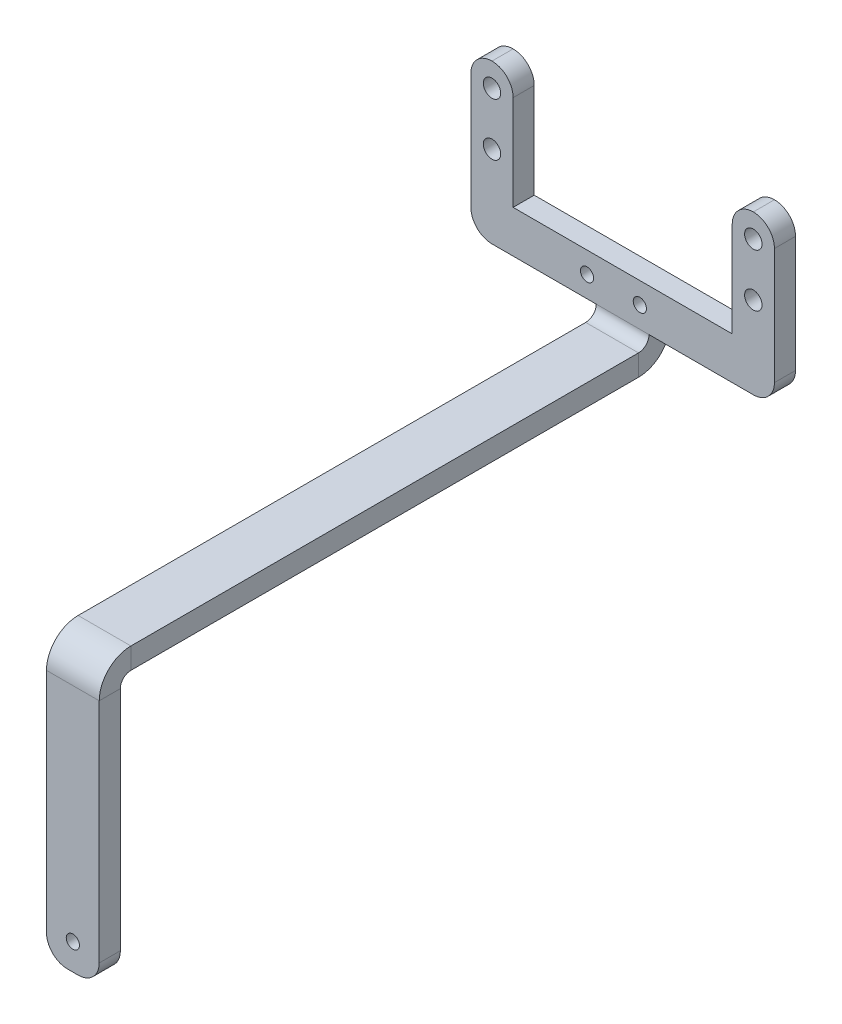
from build123d import *

# Parameters (mm, degrees)
EXTRUDE_1_DEPTH                  = 3
SHEET_METAL_1_OUTLINE_W          = 8
SHEET_METAL_1_OUTLINE_H          = 1
SHEET_METAL_1_DEPTH              = 57.5
SHEET_METAL_1_2_OUTLINE_W        = 22
SHEET_METAL_1_2_OUTLINE_H        = 1
SHEET_METAL_1_2_DEPTH            = 8
SHEET_START                      = 49.5
SHEET_METAL_1_3_OUTLINE_W        = 22
SHEET_METAL_1_3_OUTLINE_H        = 1
SHEET_METAL_1_3_DEPTH            = 8
SM_EDGE_FLANGE_1_DEPTH           = 10
SM_EDGE_FLANGE_2_STRIP_W         = 20
SM_EDGE_FLANGE_2_STRIP_H         = 4
SM_EDGE_FLANGE_2_STRIP_CUT_DEPTH = 10
SM_EDGE_FLANGE_2_DEPTH           = 10
FILLET_1_R                       = 4
M4X0_7_1_D                       = 3.3
M3X0_5_1_D                       = 2.5
M3X0_5_2_D                       = 2.5


# Read off the part's stored shape, not the designer's step: 轉換-實體1
# Sheet-metal steps are written as plain solids
with BuildPart() as part:
    # Sketch 1 → 填料-伸長1 (new body)
    with BuildSketch(Plane.XY):
        Polygon((8, 0), (8, -22), (49.5, -22), (49.5, 0), (57.5, 0), (57.5, -30), (8, -30), (0, -30), (0, 0), align=None)
    extrude(amount=EXTRUDE_1_DEPTH)

    # Sheet Metal 1 outline → Sheet Metal 1 (add)
    with BuildSketch(Plane.YZ):
        with Locations((-26, 3.5)):
            Rectangle(SHEET_METAL_1_OUTLINE_W, SHEET_METAL_1_OUTLINE_H)
    extrude(amount=SHEET_METAL_1_DEPTH)

    # Sheet Metal 1 2 outline → Sheet Metal 1 2 (add)
    with BuildSketch(Plane.YZ):
        with Locations((-11, 3.5)):
            Rectangle(SHEET_METAL_1_2_OUTLINE_W, SHEET_METAL_1_2_OUTLINE_H)
    extrude(amount=SHEET_METAL_1_2_DEPTH)

    # Sheet Metal 1 3 outline → Sheet Metal 1 3 (add)
    with BuildSketch(Plane.YZ.offset(SHEET_START)):
        with Locations((-11, 3.5)):
            Rectangle(SHEET_METAL_1_3_OUTLINE_W, SHEET_METAL_1_3_OUTLINE_H)
    extrude(amount=SHEET_METAL_1_3_DEPTH)

    # 邊線-凸緣1 section (across the edge) → 邊線-凸緣1 (add)
    with BuildSketch(Plane(origin=(23.75, -32, 4), x_dir=(0, 1, 0), z_dir=(1, 0, 0))):
        with BuildLine():
            Line((-4, 2), (-4, 104.15))
            Line((-4, 104.15), (0, 104.15))
            Line((0, 104.15), (0, 2))
            ThreePointArc((0, 2), (0.585786438, 0.585786438), (2, 0))
            Line((2, 0), (2, -4))
            ThreePointArc((2, -4), (-2.242640687, -2.242640687), (-4, 2))
        make_face()
    extrude(amount=SM_EDGE_FLANGE_1_DEPTH)

    # 邊線-凸緣2 strip (across the edge) → 邊線-凸緣2 strip cut (cut)
    with BuildSketch(Plane(origin=(33.75, -36, 108.15), x_dir=(0, 0, -1), z_dir=(-1, 0, 0))):
        with Locations((-4, -2)):
            Rectangle(SM_EDGE_FLANGE_2_STRIP_W, SM_EDGE_FLANGE_2_STRIP_H)
    extrude(amount=SM_EDGE_FLANGE_2_STRIP_CUT_DEPTH, mode=Mode.SUBTRACT)

    # 邊線-凸緣2 section (across the edge) → 邊線-凸緣2 (add)
    with BuildSketch(Plane(origin=(33.75, -36, 108.15), x_dir=(0, 0, -1), z_dir=(-1, 0, 0))):
        with BuildLine():
            Line((0, 2), (0, 49))
            Line((0, 49), (4, 49))
            Line((4, 49), (4, 2))
            ThreePointArc((4, 2), (4.585786438, 0.585786438), (6, 0))
            Line((6, 0), (6, -4))
            ThreePointArc((6, -4), (1.757359313, -2.242640687), (0, 2))
        make_face()
    extrude(amount=SM_EDGE_FLANGE_2_DEPTH)

    # 圓角1
    fillet_1_edges = [part.edges().sort_by_distance(p)[0] for p in [
        (0, -30, 2),
        (57.5, -30, 2),
        (57.5, 0, 2),
        (49.5, 0, 2),
        (8, 0, 2),
        (0, 0, 2),
        (33.75, -85, 106.15),
        (23.75, -85, 106.15),
    ]]
    fillet(fillet_1_edges, radius=FILLET_1_R - 0.0001)  # a hair under: the kernel refuses the full size

    # M4x0.7 螺紋孔1 (through all)
    with Locations(Plane(origin=(53.5, -4.45, 0), x_dir=(-1, 0, 0), z_dir=(0, 0, -1))):
        with Locations((0, 0), (0, -10), (49.5, -10), (49.5, 0)):
            Hole(M4X0_7_1_D / 2)

    # M3x0.5 螺紋孔1 (through all)
    with Locations(Plane(origin=(28.75, -80, 104.15), x_dir=(-1, 0, 0), z_dir=(0, 0, -1))):
        with Locations((0, 0)):
            Hole(M3X0_5_1_D / 2)

    # M3x0.5 螺紋孔2 (through all)
    with Locations(Plane(origin=(22, -26, 0), x_dir=(-1, 0, 0), z_dir=(0, 0, -1))):
        with Locations((0, 0), (-10, 0)):
            Hole(M3X0_5_2_D / 2)


solid = part.part
